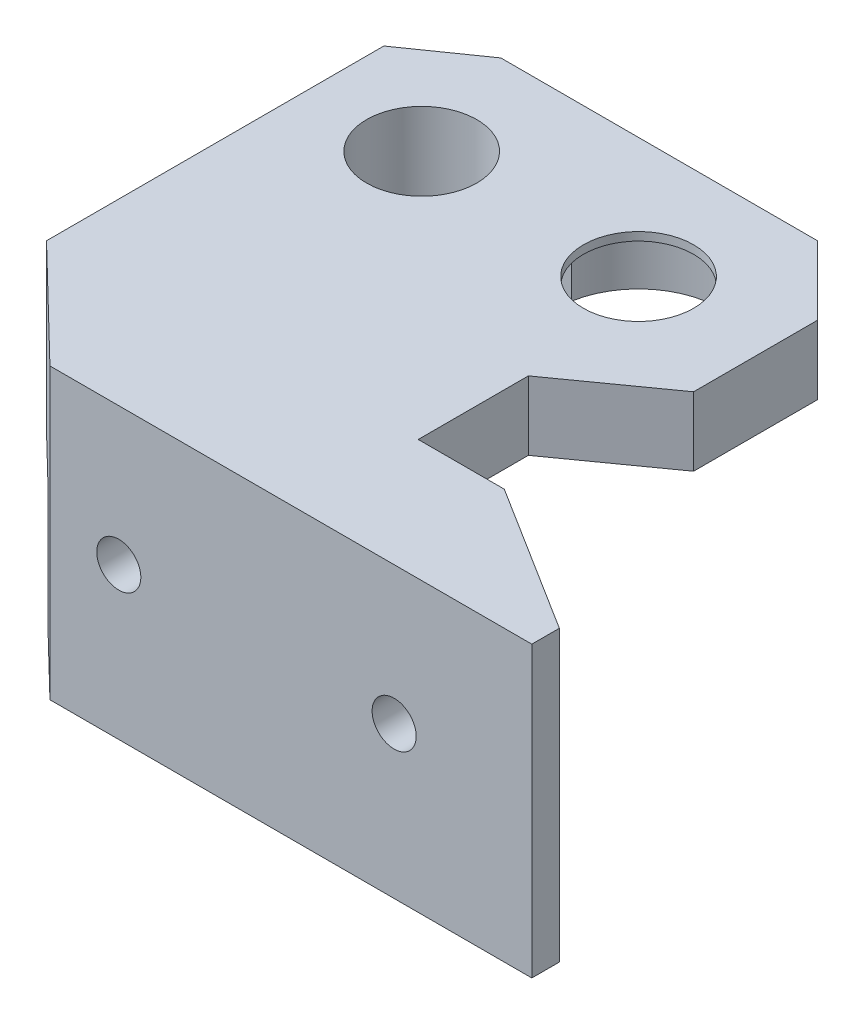
from build123d import *

# Parameters (mm, degrees)
SKETCH1_R           = 4
BOSS_EXTRUDE1_DEPTH = 5
BOSS_EXTRUDE2_DEPTH = 7
BOSS_EXTRUDE3_DEPTH = 16
BOSS_EXTRUDE4_START = 2.5
SKETCH6_R           = 7
SKETCH6_R_2         = 4
BOSS_EXTRUDE4_DEPTH = 2.5
CUT_EXTRUDE1_DEPTH  = 4.4
CUT_EXTRUDE2_DEPTH  = 42.342744224
SKETCH8_R           = 1.6
CUT_EXTRUDE3_DEPTH  = 46.805294454
SKETCH9_R           = 3
CUT_EXTRUDE4_DEPTH  = 4
SKETCH10_W          = 49.722079373
SKETCH10_H          = 35.75
CUT_EXTRUDE5_DEPTH  = 72.028603393


with BuildPart() as part:
    # Sketch1 → Boss-Extrude1 (new body)
    with BuildSketch(Plane(origin=(0, 0, 0), x_dir=(1, 0, 0), z_dir=(0, 1, 0))):
        Polygon((-4.25, 8.75), (18.75, 8.75), (23.75, 5.25), (23.75, -19.25), (15.75, -27), (-19.25, -27), (-19.25, -25), (-8.5, -18.25), (-2.25, -18.25), (-2.25, -10.25), (-9.25, -5.25), (-9.25, 3.75), align=None)
        Circle(SKETCH1_R, mode=Mode.SUBTRACT)
        with Locations((15.75, 0)):
            Circle(SKETCH1_R, mode=Mode.SUBTRACT)
    boss_extrude1 = extrude(amount=BOSS_EXTRUDE1_DEPTH)

    # Sketch2 → Boss-Extrude2 (add)
    with BuildSketch(Plane.XZ):
        Polygon((23.75, 19.25), (23.75, -5.25), (20.25, -5.25), (20.25, 18.25), (-8.5, 18.25), (-14.87037037, 22.25), (20.653225806, 22.25), align=None)
    boss_extrude2 = extrude(amount=BOSS_EXTRUDE2_DEPTH)

    # Sketch3 → Boss-Extrude3 (add)
    with BuildSketch(Plane.XZ):
        Polygon((-14.87037037, 22.25), (20.653225806, 22.25), (15.75, 27), (-19.25, 27), (-19.25, 25), align=None)
    boss_extrude3 = extrude(amount=BOSS_EXTRUDE3_DEPTH)

    # Sketch6 → Boss-Extrude4 (add)
    with BuildSketch(Plane.XZ.offset(BOSS_EXTRUDE4_START)):
        with Locations((15.75, 0)):
            Circle(SKETCH6_R)
        with Locations((15.75, 0)):
            Circle(SKETCH6_R_2, mode=Mode.SUBTRACT)
    boss_extrude4 = extrude(amount=-BOSS_EXTRUDE4_DEPTH)

    # Sketch4 → Cut-Extrude1 (cut)
    with BuildSketch(Plane.XZ):
        with BuildLine():
            Line((5.883782294, -1), (12.395898034, -1))
            ThreePointArc((12.395898034, -1), (12.25, 0), (12.395898034, 1))
            Line((12.395898034, 1), (5.883782294, 1))
            ThreePointArc((5.883782294, 1), (-5.968156673, 0), (5.883782294, -1))
        make_face()
    cut_extrude1 = extrude(amount=-CUT_EXTRUDE1_DEPTH, mode=Mode.SUBTRACT)

    # Sketch7 → Cut-Extrude2 (cut, through all)
    with BuildSketch(Plane.XZ.offset(-4.4)):
        with BuildLine():
            Line((5.883782294, -1), (11.877016654, -1))
            ThreePointArc((11.877016654, -1), (11.75, 0), (11.877016654, 1))
            Line((11.877016654, 1), (5.883782294, 1))
            ThreePointArc((5.883782294, 1), (-5.968156673, 0), (5.883782294, -1))
        make_face()
    cut_extrude2 = extrude(amount=CUT_EXTRUDE2_DEPTH, mode=Mode.SUBTRACT)

    # Sketch8 → Cut-Extrude3 (cut, through all)
    with BuildSketch(Plane.XY.offset(27)):
        with Locations((10.75, -5)):
            Circle(SKETCH8_R)
        with Locations((-9.25, -5)):
            Circle(SKETCH8_R)
    cut_extrude3 = extrude(amount=-CUT_EXTRUDE3_DEPTH, mode=Mode.SUBTRACT)

    # Sketch9 → Cut-Extrude4 (cut)
    with BuildSketch(Plane(origin=(0, 0, 18.25), x_dir=(-1, 0, 0), z_dir=(0, 0, -1))):
        with Locations((-10.75, -5)):
            Circle(SKETCH9_R)
        with Locations((9.25, -5)):
            Circle(SKETCH9_R)
    cut_extrude4 = extrude(amount=-CUT_EXTRUDE4_DEPTH, mode=Mode.SUBTRACT)

    # Mirror1: Boss-Extrude1, Boss-Extrude2, Boss-Extrude3, Boss-Extrude4, Cut-Extrude1, Cut-Extrude2, Cut-Extrude3, Cut-Extrude4 across plane
    add(boss_extrude1.mirror(Plane(origin=(-19.25, 5, 27), x_dir=(0, 0, 1), z_dir=(1, 0, 0))))
    add(boss_extrude2.mirror(Plane(origin=(-19.25, 5, 27), x_dir=(0, 0, 1), z_dir=(1, 0, 0))))
    add(boss_extrude3.mirror(Plane(origin=(-19.25, 5, 27), x_dir=(0, 0, 1), z_dir=(1, 0, 0))))
    add(boss_extrude4.mirror(Plane(origin=(-19.25, 5, 27), x_dir=(0, 0, 1), z_dir=(1, 0, 0))))
    add(cut_extrude1.mirror(Plane(origin=(-19.25, 5, 27), x_dir=(0, 0, 1), z_dir=(1, 0, 0))), mode=Mode.SUBTRACT)
    add(cut_extrude2.mirror(Plane(origin=(-19.25, 5, 27), x_dir=(0, 0, 1), z_dir=(1, 0, 0))), mode=Mode.SUBTRACT)
    add(cut_extrude3.mirror(Plane(origin=(-19.25, 5, 27), x_dir=(0, 0, 1), z_dir=(1, 0, 0))), mode=Mode.SUBTRACT)
    add(cut_extrude4.mirror(Plane(origin=(-19.25, 5, 27), x_dir=(0, 0, 1), z_dir=(1, 0, 0))), mode=Mode.SUBTRACT)

    # Sketch10 → Cut-Extrude5 (cut, through all)
    with BuildSketch(Plane(origin=(0, 5, 0), x_dir=(1, 0, 0), z_dir=(0, 1, 0))):
        with Locations((5.611039687, -9.125)):
            Rectangle(SKETCH10_W, SKETCH10_H)
    extrude(amount=-CUT_EXTRUDE5_DEPTH, mode=Mode.SUBTRACT)


solid = part.part
